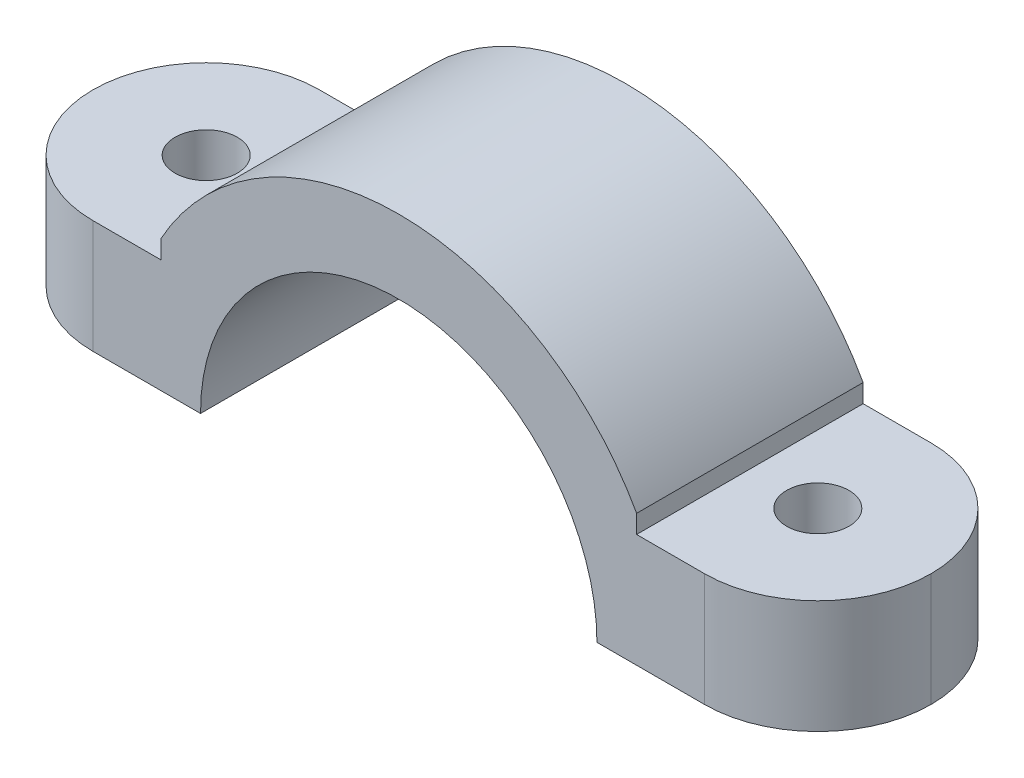
from build123d import *

# Parameters (mm, degrees)
BOSS_EXTRUDE1_DEPTH      = 20
BOSS_EXTRUDE1_DEPTH_BACK = 20
SKETCH7_R                = 5.5
CUT_EXTRUDE5_DEPTH       = 20
FILLET8_R                = 20


with BuildPart() as part:
    # Sketch1 → Boss-Extrude1 (new, two sides: drawn at the far end of the back side and taken through both)
    with BuildSketch(Plane.XY.offset(-BOSS_EXTRUDE1_DEPTH_BACK)):
        with BuildLine():
            Line((35, 0), (74, 0))
            Line((74, 0), (74, 20))
            Line((74, 20), (42, 20))
            Line((42, 20), (42, 23.237900077))
            ThreePointArc((42, 23.237900077), (0, 48), (-42, 23.237900077))
            Line((-42, 23.237900077), (-42, 20))
            Line((-42, 20), (-74, 20))
            Line((-74, 20), (-74, 0))
            Line((-74, 0), (-35, 0))
            ThreePointArc((-35, 0), (0, 35), (35, 0))
        make_face()
    extrude(amount=BOSS_EXTRUDE1_DEPTH + BOSS_EXTRUDE1_DEPTH_BACK)

    # Sketch7 → Cut-Extrude5 (cut)
    with BuildSketch(Plane(origin=(0, 20, 0), x_dir=(1, 0, 0), z_dir=(0, 1, 0))):
        with Locations(Location((54, 0, 0), (0, 0, 270))):
            Circle(SKETCH7_R)
        with Locations(Location((-54, 0, 0), (0, 0, 270))):
            Circle(SKETCH7_R)
    extrude(amount=-CUT_EXTRUDE5_DEPTH, mode=Mode.SUBTRACT)

    # Fillet8
    fillet8_edges = [part.edges().sort_by_distance(p)[0] for p in [
        (-74, 10, -20),
        (-74, 10, 20),
        (74, 10, -20),
        (74, 10, 20),
    ]]
    fillet(fillet8_edges, radius=FILLET8_R - 0.0001)  # a hair under: the kernel refuses the full size


solid = part.part
